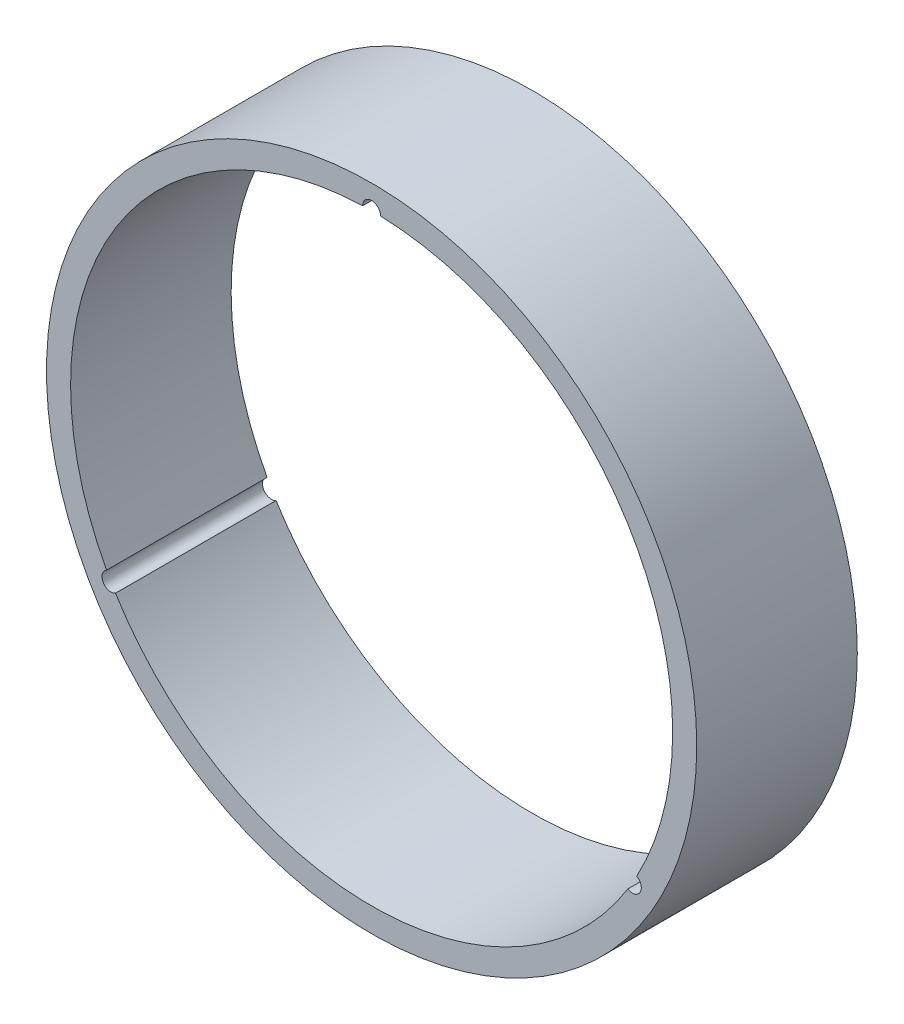
from build123d import *

# Parameters (mm, degrees)
SKETCH1_R           = 81
BOSS_EXTRUDE1_DEPTH = 20


with BuildPart() as part:
    # Sketch1 → Boss-Extrude1 (new, symmetric)
    with BuildSketch(Plane.XY):
        Circle(SKETCH1_R)
        with BuildLine():
            ThreePointArc((2.231689825, 74.966789717), (53.816246324, 52.238028596), (75, 0))
            ThreePointArc((75, 0), (72.725250751, -18.331336645), (66.038989248, -35.550694777))
            ThreePointArc((66.038989248, -35.550694777), (66.876463055, -36.369681556), (67.1838422, -37.5))
            ThreePointArc((67.1838422, -37.5), (66.053461983, -39.441163372), (63.807299423, -39.416094941))
            ThreePointArc((63.807299423, -39.416094941), (0, -75), (-63.807299423, -39.416094941))
            ThreePointArc((-63.807299423, -39.416094941), (-66.884819353, -38.615968458), (-66.038989248, -35.550694777))
            ThreePointArc((-66.038989248, -35.550694777), (-64.951905284, 37.5), (-2.231689825, 74.966789717))
            ThreePointArc((-2.231689825, 74.966789717), (-0.016605601, 77.231875143), (2.231936916, 75))
            ThreePointArc((2.231936916, 75), (2.231875143, 74.983394399), (2.231689825, 74.966789717))
        make_face(mode=Mode.SUBTRACT)
    extrude(amount=BOSS_EXTRUDE1_DEPTH, both=True)


solid = part.part
